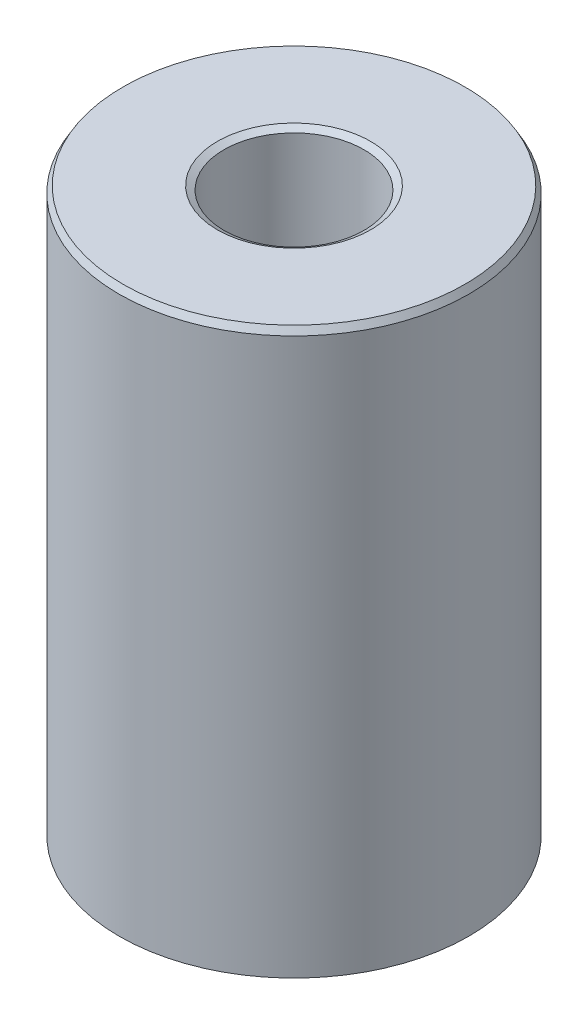
from build123d import *
from OCP.BRepFilletAPI import BRepFilletAPI_MakeChamfer

# Parameters (mm, degrees)
SKETCH1_R           = 7.5
BOSS_EXTRUDE1_DEPTH = 24.306583043
SKETCH2_R           = 3.003160758
CUT_EXTRUDE1_DEPTH  = 27.519992067
CHAMFER1_SIZE       = 0.285915795
CHAMFER1_SIZE2      = 0.165073561


with BuildPart() as part:
    # Sketch1 → Boss-Extrude1 (new body)
    with BuildSketch(Plane(origin=(0, 0, 0), x_dir=(1, 0, 0), z_dir=(0, 1, 0))):
        Circle(SKETCH1_R)
    extrude(amount=BOSS_EXTRUDE1_DEPTH)

    # Sketch2 → Cut-Extrude1 (cut, through all)
    with BuildSketch(Plane(origin=(0, 0, 0), x_dir=(1, 0, 0), z_dir=(0, 1, 0))):
        Circle(SKETCH2_R)
    extrude(amount=CUT_EXTRUDE1_DEPTH, mode=Mode.SUBTRACT)

    # Chamfer1: one chamfer whose edges measure the first distance from different faces: ONE call of the kernel's chamfer builder (chamfer() names one face for all edges)
    chamfer1_edges_1 = [part.edges().sort_by_distance(p)[0] for p in [
        (-3.003160758, 24.306583043, 0),
    ]]
    chamfer1_side_1 = [part.faces().sort_by_distance(p)[0] for p in [
        (-7.287867966, 24.306583043, 0),
    ]]
    chamfer1_edges_2 = [part.edges().sort_by_distance(p)[0] for p in [
        (-3.003160758, 0, 0),
    ]]
    chamfer1_side_2 = [part.faces().sort_by_distance(p)[0] for p in [
        (-3.003160758, 12.153291522, 0),
    ]]
    chamfer1_edges_3 = [part.edges().sort_by_distance(p)[0] for p in [
        (-7.5, 0, 0),
    ]]
    chamfer1_side_3 = [part.faces().sort_by_distance(p)[0] for p in [
        (-7.287867966, 0, 0),
    ]]
    chamfer1_edges_4 = [part.edges().sort_by_distance(p)[0] for p in [
        (-7.5, 24.306583043, 0),
    ]]
    chamfer1_side_4 = [part.faces().sort_by_distance(p)[0] for p in [
        (-7.5, 12.153291522, 0),
    ]]
    chamfer1 = BRepFilletAPI_MakeChamfer(part.part.solid().wrapped)
    for e in chamfer1_edges_1:
        chamfer1.Add(CHAMFER1_SIZE, CHAMFER1_SIZE2, e.wrapped, chamfer1_side_1[0].wrapped)  # the first distance lies on this face
    for e in chamfer1_edges_2:
        chamfer1.Add(CHAMFER1_SIZE, CHAMFER1_SIZE2, e.wrapped, chamfer1_side_2[0].wrapped)  # the first distance lies on this face
    for e in chamfer1_edges_3:
        chamfer1.Add(CHAMFER1_SIZE, CHAMFER1_SIZE2, e.wrapped, chamfer1_side_3[0].wrapped)  # the first distance lies on this face
    for e in chamfer1_edges_4:
        chamfer1.Add(CHAMFER1_SIZE, CHAMFER1_SIZE2, e.wrapped, chamfer1_side_4[0].wrapped)  # the first distance lies on this face
    add(Compound.cast(chamfer1.Shape()), mode=Mode.REPLACE)


solid = part.part
